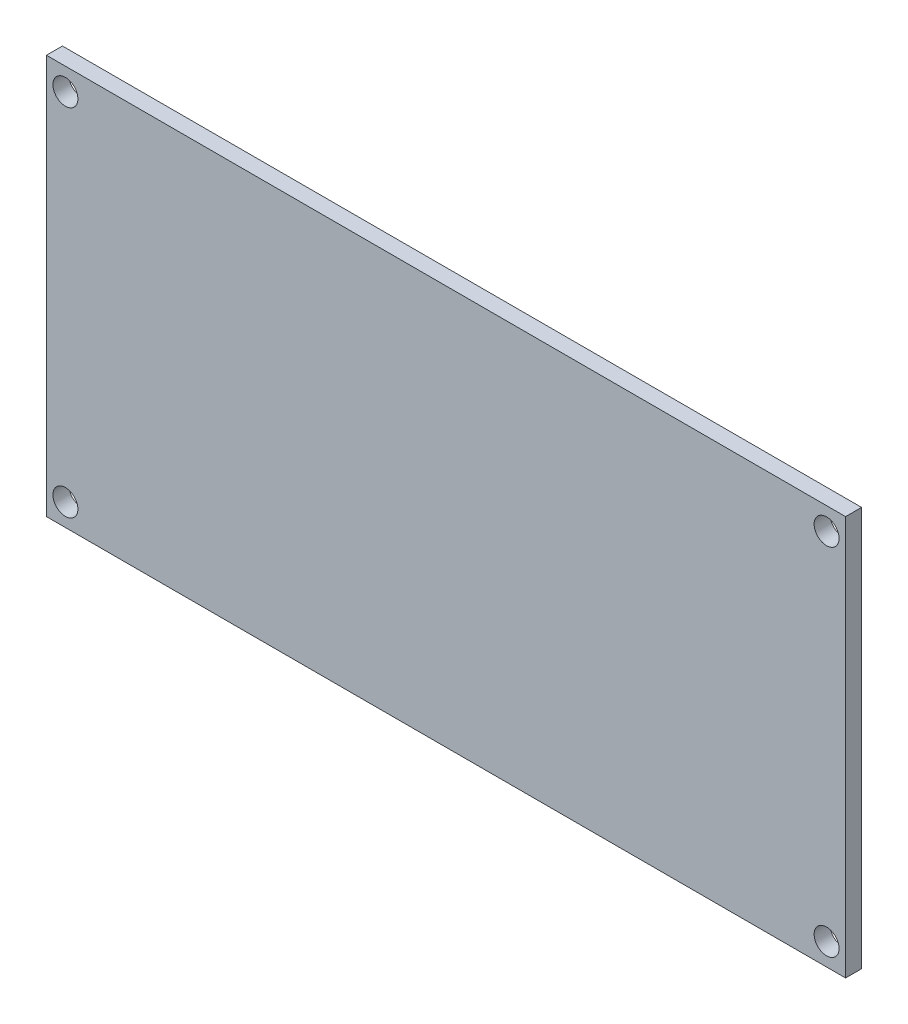
from build123d import *

# Parameters (mm, degrees)
ESQUISSE1_W        = 80
ESQUISSE1_H        = 40
ESQUISSE1_R        = 1.25
BOSS_EXTRU_1_DEPTH = 1.6


with BuildPart() as part:
    # Esquisse1 → Boss.-Extru.1 (new body)
    with BuildSketch(Plane.XY):
        Rectangle(ESQUISSE1_W, ESQUISSE1_H)
        with Locations((-38.1, 17.78)):
            Circle(ESQUISSE1_R, mode=Mode.SUBTRACT)
        with Locations((-38.1, -17.78)):
            Circle(ESQUISSE1_R, mode=Mode.SUBTRACT)
        with Locations((38.1, -17.78)):
            Circle(ESQUISSE1_R, mode=Mode.SUBTRACT)
        with Locations((38.1, 17.78)):
            Circle(ESQUISSE1_R, mode=Mode.SUBTRACT)
    extrude(amount=BOSS_EXTRU_1_DEPTH)


solid = part.part
